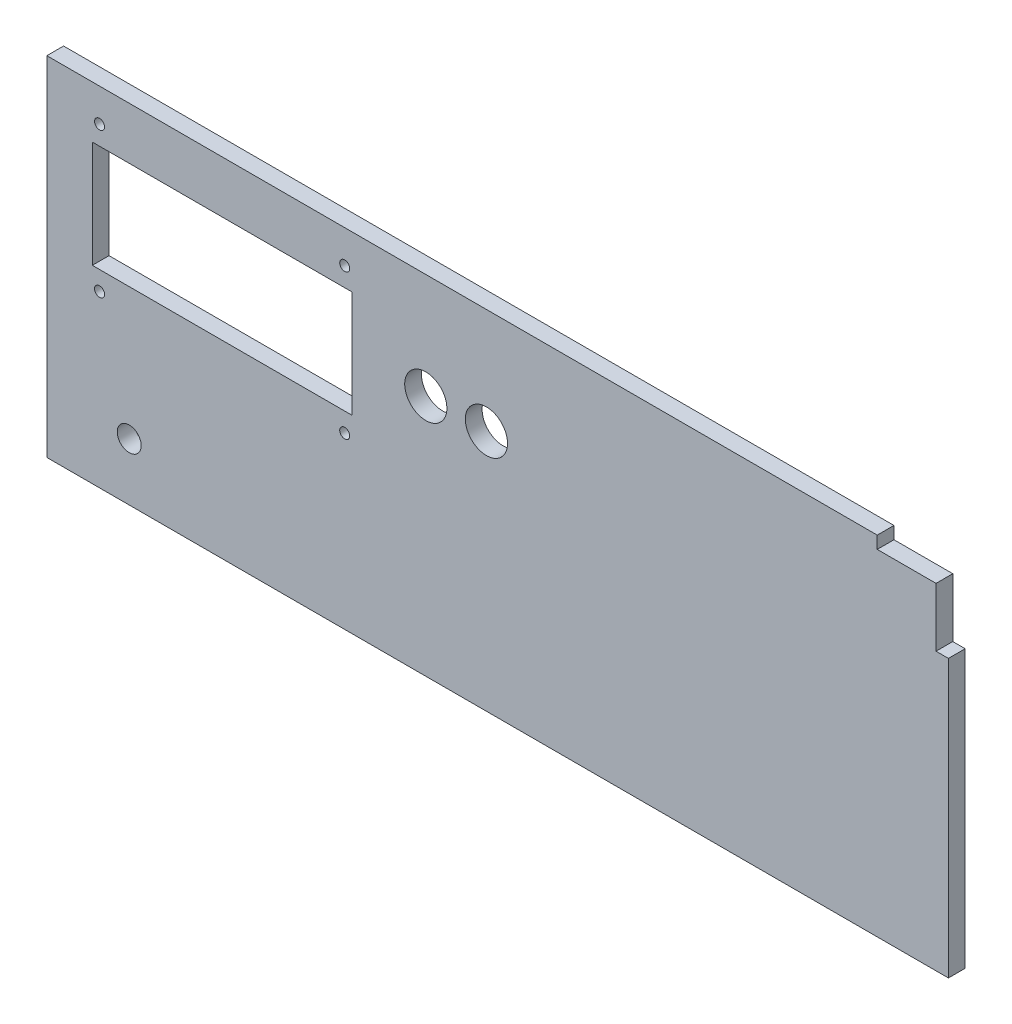
from build123d import *

# Parameters (mm, degrees)
SKETCH1_R           = 1.9
SKETCH1_R_2         = 8
SKETCH1_R_3         = 4.55
SKETCH1_W           = 98.5
SKETCH1_H           = 40.5
BOSS_EXTRUDE1_DEPTH = 6.35


with BuildPart() as part:
    # Sketch1 → Boss-Extrude1 (new body)
    with BuildSketch(Plane.XY):
        Polygon((0, 0), (342, 0), (342, 105), (337.3, 105), (337.3, 127.3), (315, 127.3), (315, 132), (0, 132), align=None)
        with Locations((112.999995121, 119.499997115)):
            Circle(SKETCH1_R, mode=Mode.SUBTRACT)
        with Locations((113.000004879, 64.499997115)):
            Circle(SKETCH1_R, mode=Mode.SUBTRACT)
        with Locations((20.000004879, 64.500002885)):
            Circle(SKETCH1_R, mode=Mode.SUBTRACT)
        with Locations((19.999995121, 119.500002885)):
            Circle(SKETCH1_R, mode=Mode.SUBTRACT)
        with Locations((143.75, 92)):
            Circle(SKETCH1_R_2, mode=Mode.SUBTRACT)
        with Locations((166.75, 92)):
            Circle(SKETCH1_R_2, mode=Mode.SUBTRACT)
        with Locations((31.25, 21.75)):
            Circle(SKETCH1_R_3, mode=Mode.SUBTRACT)
        with Locations((66.5, 92)):
            Rectangle(SKETCH1_W, SKETCH1_H, mode=Mode.SUBTRACT)
    extrude(amount=BOSS_EXTRUDE1_DEPTH)


solid = part.part
